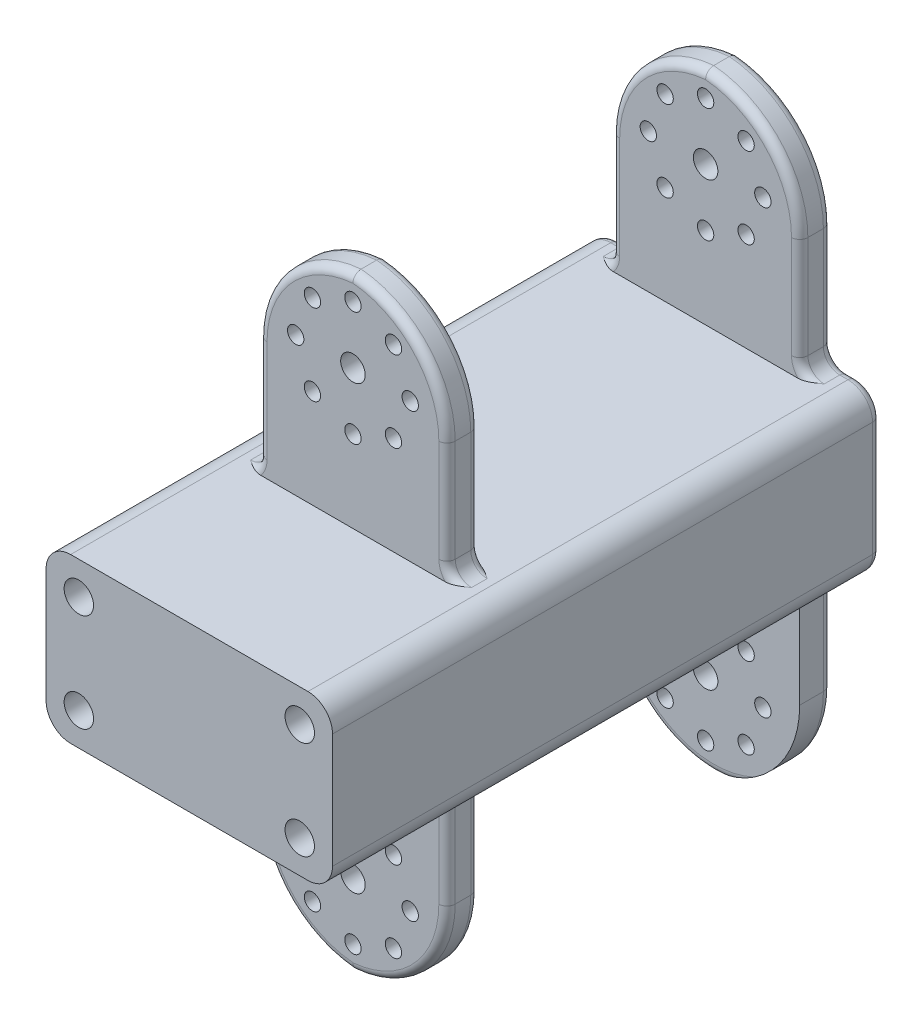
from build123d import *

# Parameters (mm, degrees)
SKETCH1_W           = 35
SKETCH1_H           = 47
BOSS_EXTRUDE1_DEPTH = 20
SKETCH7_W           = 35
SKETCH7_H           = 20
BOSS_EXTRUDE3_DEPTH = 20
SKETCH2_W           = 23
SKETCH2_H           = 3.9
BOSS_EXTRUDE5_DEPTH = 27
SKETCH10_R          = 1
SKETCH10_R_2        = 1.5
CUT_EXTRUDE3_DEPTH  = 50
FILLET1_R           = 12.5
FILLET3_R           = 3
FILLET4_R           = 2
FILLET5_R           = 1
SKETCH11_R          = 1.8
CUT_EXTRUDE4_DEPTH  = 3


with BuildPart() as part:
    # Sketch1 → Boss-Extrude1 (new body)
    with BuildSketch(Plane(origin=(0, 0, 0), x_dir=(1, 0, 0), z_dir=(0, 1, 0))):
        with Locations((5, 1)):
            Rectangle(SKETCH1_W, SKETCH1_H)
    extrude(amount=BOSS_EXTRUDE1_DEPTH)

    # Sketch7 → Boss-Extrude3 (add)
    with BuildSketch(Plane.XY.offset(22.5)):
        with Locations((5, 10)):
            Rectangle(SKETCH7_W, SKETCH7_H)
    extrude(amount=BOSS_EXTRUDE3_DEPTH)

    # Sketch2 → Boss-Extrude5 (add)
    with BuildSketch(Plane.XZ):
        with Locations((5, -22.55)):
            Rectangle(SKETCH2_W, SKETCH2_H)
        with Locations((5, 20.55)):
            Rectangle(SKETCH2_W, SKETCH2_H)
    boss_extrude5 = extrude(amount=BOSS_EXTRUDE5_DEPTH)

    # Sketch10 → Cut-Extrude3 (cut)
    with BuildSketch(Plane(origin=(0, 0, -24.5), x_dir=(-1, 0, 0), z_dir=(0, 0, -1))):
        with Locations((-5, -24)):
            Circle(SKETCH10_R)
        with Locations((-5, -17)):
            Circle(SKETCH10_R_2)
        with Locations((-9.949747468, -21.949747468)):
            Circle(SKETCH10_R)
        with Locations((-0.050252532, -21.949747468)):
            Circle(SKETCH10_R)
        with Locations((-12, -17)):
            Circle(SKETCH10_R)
        with Locations((2, -17)):
            Circle(SKETCH10_R)
        with Locations((-9.949747468, -12.050252532)):
            Circle(SKETCH10_R)
        with Locations((-0.050252532, -12.050252532)):
            Circle(SKETCH10_R)
        with Locations((-5, -10)):
            Circle(SKETCH10_R)
    cut_extrude3 = extrude(amount=-CUT_EXTRUDE3_DEPTH, mode=Mode.SUBTRACT)

    # Mirror3: Boss-Extrude5, Cut-Extrude3 across plane
    add(boss_extrude5.mirror(Plane.ZX.offset(10)))
    add(cut_extrude3.mirror(Plane.ZX.offset(10)), mode=Mode.SUBTRACT)

    # Fillet1
    # the kernel refuses this fillet: 12.5 mm, written as the material it takes off along each edge
    with BuildSketch(Plane(origin=(-6.5, 47, 53.75), x_dir=(0, -1, 0), z_dir=(0, 0, -1)), Plane(origin=(16.5, 47, -12.65), x_dir=(0, -1, 0), z_dir=(0, 0, 1)), Plane(origin=(-6.5, 47, 10.65), x_dir=(0, -1, 0), z_dir=(0, 0, -1)), Plane(origin=(16.5, -27, -55.75), x_dir=(-1, 0, 0), z_dir=(0, 0, 1))) as fillet1_piece_1:
        with BuildLine():
            CenterArc((FILLET1_R, -FILLET1_R), FILLET1_R, 90, 90)
            Line((0, -FILLET1_R), (0, 0))
            Line((0, 0), (FILLET1_R, 0))
        make_face()
    extrude(amount=66.4, mode=Mode.SUBTRACT)
    with BuildSketch(Plane(origin=(16.5, 47, -55.75), x_dir=(-1, 0, 0), z_dir=(0, 0, 1)), Plane(origin=(-6.5, -27, 10.65), x_dir=(0, 1, 0), z_dir=(0, 0, -1)), Plane(origin=(-6.5, -27, 53.75), x_dir=(0, 1, 0), z_dir=(0, 0, -1)), Plane(origin=(16.5, -27, -12.65), x_dir=(0, 1, 0), z_dir=(0, 0, 1))) as fillet1_piece_2:
        with BuildLine():
            CenterArc((FILLET1_R, FILLET1_R), FILLET1_R, 180, 90)
            Line((0, FILLET1_R), (0, 0))
            Line((0, 0), (FILLET1_R, 0))
        make_face()
    extrude(amount=66.4, mode=Mode.SUBTRACT)

    # Fillet3
    fillet3_edges = [part.edges().sort_by_distance(p)[0] for p in [
        (22.5, 20, 9),
        (-12.5, 20, 9),
        (22.5, 0, 9),
        (-12.5, 0, 9),
    ]]
    fillet(fillet3_edges, radius=FILLET3_R)

    # Fillet4
    fillet4_edges = [part.edges().sort_by_distance(p)[0] for p in [
        (-6.5, 20, 20.55),
        (16.5, 20, 20.55),
        (-6.5, 20, -22.55),
        (16.5, 20, -22.55),
        (-6.5, 0, 20.55),
        (16.5, 0, 20.55),
        (-6.5, 0, -22.55),
        (16.5, 0, -22.55),
    ]]
    fillet(fillet4_edges, radius=FILLET4_R)

    # Fillet5
    # the kernel refuses this fillet: 1 mm, written as the material it takes off along each edge
    with BuildSketch(Plane(origin=(-6.5, 22, 22.5), x_dir=(0, 0, -1), z_dir=(0, 1, 0)), Plane(origin=(-6.5, 22, 18.6), x_dir=(1, 0, 0), z_dir=(0, 1, 0)), Plane(origin=(-6.5, 22, -24.5), x_dir=(1, 0, 0), z_dir=(0, 1, 0)), Plane(origin=(16.5, -2, -24.5), x_dir=(-1, 0, 0), z_dir=(0, -1, 0)), Plane(origin=(16.5, 22, -20.6), x_dir=(-1, 0, 0), z_dir=(0, 1, 0)), Plane(origin=(-6.5, -2, -20.6), x_dir=(1, 0, 0), z_dir=(0, -1, 0)), Plane(origin=(-6.5, -2, 18.6), x_dir=(0, 0, 1), z_dir=(0, -1, 0)), Plane(origin=(16.5, -2, 22.5), x_dir=(0, 0, -1), z_dir=(0, -1, 0))) as fillet5_piece_1:
        with BuildLine():
            CenterArc((FILLET5_R, -FILLET5_R), FILLET5_R, 90, 90)
            Line((0, -FILLET5_R), (0, 0))
            Line((0, 0), (FILLET5_R, 0))
        make_face()
    extrude(amount=12.5, mode=Mode.SUBTRACT)
    with BuildSketch(Plane(origin=(16.5, 22, 18.6), x_dir=(-1, 0, 0), z_dir=(0, 1, 0)), Plane(origin=(16.5, 22, 22.5), x_dir=(0, 0, -1), z_dir=(0, 1, 0)), Plane(origin=(-6.5, 22, -20.6), x_dir=(1, 0, 0), z_dir=(0, 1, 0)), Plane(origin=(-6.5, -2, -24.5), x_dir=(1, 0, 0), z_dir=(0, -1, 0)), Plane(origin=(16.5, 22, -24.5), x_dir=(-1, 0, 0), z_dir=(0, 1, 0)), Plane(origin=(16.5, -2, 18.6), x_dir=(0, 0, 1), z_dir=(0, -1, 0)), Plane(origin=(-6.5, -2, 22.5), x_dir=(0, 0, -1), z_dir=(0, -1, 0))) as fillet5_piece_2:
        with BuildLine():
            CenterArc((FILLET5_R, FILLET5_R), FILLET5_R, 180, 90)
            Line((0, FILLET5_R), (0, 0))
            Line((0, 0), (FILLET5_R, 0))
        make_face()
    extrude(amount=12.5, mode=Mode.SUBTRACT)
    with BuildSketch(Plane(origin=(4, 34.5, 18.6), x_dir=(-0.49699424174803253, 0.8677538381760683, 0), z_dir=(-0.8677538381760683, -0.49699424174803253, 0))) as fillet5_piece_3:
        with BuildLine():
            CenterArc((12.5 - FILLET5_R, -FILLET5_R), FILLET5_R, 360, 90)
            Line((12.5, -FILLET5_R), (12.5, 0))
            Line((12.5, 0), (12.5 - FILLET5_R, 0))
        make_face()
    revolve(axis=Axis((4, 34.5, 18.6), (0, 0, -1)), revolution_arc=119.80133908, mode=Mode.SUBTRACT)
    with BuildSketch(Plane(origin=(6, 34.5, 18.6), x_dir=(0.4969942417480113, 0.8677538381760804, 0), z_dir=(0.8677538381760804, -0.4969942417480113, 0))) as fillet5_piece_4:
        with BuildLine():
            CenterArc((12.5 - FILLET5_R, FILLET5_R), FILLET5_R, 270, 90)
            Line((12.5, FILLET5_R), (12.5, 0))
            Line((12.5, 0), (12.5 - FILLET5_R, 0))
        make_face()
    revolve(axis=Axis((6, 34.5, 18.6), (0, 0, 1)), revolution_arc=119.80133908, mode=Mode.SUBTRACT)
    with BuildSketch(Plane(origin=(4, 34.5, 22.5), x_dir=(-0.4969942417480322, 0.8677538381760685, 0), z_dir=(-0.8677538381760685, -0.4969942417480322, 0))) as fillet5_piece_5:
        with BuildLine():
            CenterArc((12.5 - FILLET5_R, FILLET5_R), FILLET5_R, 270, 90)
            Line((12.5 - FILLET5_R, 0), (12.5, 0))
            Line((12.5, 0), (12.5, FILLET5_R))
        make_face()
    revolve(axis=Axis((4, 34.5, 22.5), (0, 0, -1)), revolution_arc=119.80133908, mode=Mode.SUBTRACT)
    with BuildSketch(Plane(origin=(6, 34.5, 22.5), x_dir=(0.4969942417480117, 0.8677538381760802, 0), z_dir=(0.8677538381760802, -0.4969942417480117, 0))) as fillet5_piece_6:
        with BuildLine():
            CenterArc((12.5 - FILLET5_R, -FILLET5_R), FILLET5_R, 0, 90)
            Line((12.5 - FILLET5_R, 0), (12.5, 0))
            Line((12.5, 0), (12.5, -FILLET5_R))
        make_face()
    revolve(axis=Axis((6, 34.5, 22.5), (0, 0, 1)), revolution_arc=119.80133908, mode=Mode.SUBTRACT)
    with BuildSketch(Plane(origin=(4, -14.5, -24.5), x_dir=(1, 0, 0), z_dir=(0, 1, 0))) as fillet5_piece_7:
        with BuildLine():
            CenterArc((12.5 - FILLET5_R, -FILLET5_R), FILLET5_R, 0, 90)
            Line((12.5, -FILLET5_R), (12.5, 0))
            Line((12.5, 0), (12.5 - FILLET5_R, 0))
        make_face()
    revolve(axis=Axis((4, -14.5, -24.5), (0, 0, -1)), revolution_arc=119.80133908, mode=Mode.SUBTRACT)
    with BuildSketch(Plane(origin=(6, -14.5, -24.5), x_dir=(-1, 0, 0), z_dir=(0, 1, 0))) as fillet5_piece_8:
        with BuildLine():
            CenterArc((12.5 - FILLET5_R, FILLET5_R), FILLET5_R, 270, 90)
            Line((12.5, FILLET5_R), (12.5, 0))
            Line((12.5, 0), (12.5 - FILLET5_R, 0))
        make_face()
    revolve(axis=Axis((6, -14.5, -24.5), (0, 0, 1)), revolution_arc=119.80133908, mode=Mode.SUBTRACT)
    with BuildSketch(Plane(origin=(4, 34.5, -24.5), x_dir=(-0.4969942417480215, 0.8677538381760747, 0), z_dir=(-0.8677538381760747, -0.4969942417480215, 0))) as fillet5_piece_9:
        with BuildLine():
            CenterArc((12.5 - FILLET5_R, -FILLET5_R), FILLET5_R, 0, 90)
            Line((12.5, -FILLET5_R), (12.5, 0))
            Line((12.5, 0), (12.5 - FILLET5_R, 0))
        make_face()
    revolve(axis=Axis((4, 34.5, -24.5), (0, 0, -1)), revolution_arc=119.80133908, mode=Mode.SUBTRACT)
    with BuildSketch(Plane(origin=(6, 34.5, -24.5), x_dir=(0.4969942417480217, 0.8677538381760745, 0), z_dir=(0.8677538381760745, -0.4969942417480217, 0))) as fillet5_piece_10:
        with BuildLine():
            CenterArc((12.5 - FILLET5_R, FILLET5_R), FILLET5_R, 270, 90)
            Line((12.5, FILLET5_R), (12.5, 0))
            Line((12.5, 0), (12.5 - FILLET5_R, 0))
        make_face()
    revolve(axis=Axis((6, 34.5, -24.5), (0, 0, 1)), revolution_arc=119.80133908, mode=Mode.SUBTRACT)
    with BuildSketch(Plane(origin=(4, 34.5, -20.6), x_dir=(-0.4969942417480215, 0.8677538381760747, 0), z_dir=(-0.8677538381760747, -0.4969942417480215, 0))) as fillet5_piece_11:
        with BuildLine():
            CenterArc((12.5 - FILLET5_R, FILLET5_R), FILLET5_R, 270, 90)
            Line((12.5, FILLET5_R), (12.5, 0))
            Line((12.5, 0), (12.5 - FILLET5_R, 0))
        make_face()
    revolve(axis=Axis((4, 34.5, -20.6), (0, 0, -1)), revolution_arc=119.80133908, mode=Mode.SUBTRACT)
    with BuildSketch(Plane(origin=(6, 34.5, -20.6), x_dir=(0.4969942417480217, 0.8677538381760745, 0), z_dir=(0.8677538381760745, -0.4969942417480217, 0))) as fillet5_piece_12:
        with BuildLine():
            CenterArc((12.5 - FILLET5_R, -FILLET5_R), FILLET5_R, 0, 90)
            Line((12.5, -FILLET5_R), (12.5, 0))
            Line((12.5, 0), (12.5 - FILLET5_R, 0))
        make_face()
    revolve(axis=Axis((6, 34.5, -20.6), (0, 0, 1)), revolution_arc=119.80133908, mode=Mode.SUBTRACT)
    with BuildSketch(Plane(origin=(6, -14.5, -20.6), x_dir=(-1, 0, 0), z_dir=(0, 1, 0))) as fillet5_piece_13:
        with BuildLine():
            CenterArc((12.5 - FILLET5_R, -FILLET5_R), FILLET5_R, 0, 90)
            Line((12.5, -FILLET5_R), (12.5, 0))
            Line((12.5, 0), (12.5 - FILLET5_R, 0))
        make_face()
    revolve(axis=Axis((6, -14.5, -20.6), (0, 0, 1)), revolution_arc=119.80133908, mode=Mode.SUBTRACT)
    with BuildSketch(Plane(origin=(4, -14.5, 18.6), x_dir=(1, 0, 0), z_dir=(0, 1, 0))) as fillet5_piece_14:
        with BuildLine():
            CenterArc((12.5 - FILLET5_R, -FILLET5_R), FILLET5_R, 0, 90)
            Line((12.5 - FILLET5_R, 0), (12.5, 0))
            Line((12.5, 0), (12.5, -FILLET5_R))
        make_face()
    revolve(axis=Axis((4, -14.5, 18.6), (0, 0, -1)), revolution_arc=119.80133908, mode=Mode.SUBTRACT)
    with BuildSketch(Plane(origin=(6, -14.5, 18.6), x_dir=(-1, 0, 0), z_dir=(0, 1, 0))) as fillet5_piece_15:
        with BuildLine():
            CenterArc((12.5 - FILLET5_R, FILLET5_R), FILLET5_R, 270, 90)
            Line((12.5 - FILLET5_R, 0), (12.5, 0))
            Line((12.5, 0), (12.5, FILLET5_R))
        make_face()
    revolve(axis=Axis((6, -14.5, 18.6), (0, 0, 1)), revolution_arc=119.80133908, mode=Mode.SUBTRACT)
    with BuildSketch(Plane(origin=(4, -14.5, 22.5), x_dir=(1, 0, 0), z_dir=(0, 1, 0))) as fillet5_piece_16:
        with BuildLine():
            CenterArc((12.5 - FILLET5_R, FILLET5_R), FILLET5_R, 270, 90)
            Line((12.5 - FILLET5_R, 0), (12.5, 0))
            Line((12.5, 0), (12.5, FILLET5_R))
        make_face()
    revolve(axis=Axis((4, -14.5, 22.5), (0, 0, -1)), revolution_arc=119.80133908, mode=Mode.SUBTRACT)
    with BuildSketch(Plane(origin=(6, -14.5, 22.5), x_dir=(-1, 0, 0), z_dir=(0, 1, 0))) as fillet5_piece_17:
        with BuildLine():
            CenterArc((12.5 - FILLET5_R, -FILLET5_R), FILLET5_R, 0, 90)
            Line((12.5 - FILLET5_R, 0), (12.5, 0))
            Line((12.5, 0), (12.5, -FILLET5_R))
        make_face()
    revolve(axis=Axis((6, -14.5, 22.5), (0, 0, 1)), revolution_arc=119.80133908, mode=Mode.SUBTRACT)
    with BuildSketch(Plane(origin=(-12.5, 3, -24.5), x_dir=(1, 0, 0), z_dir=(0, 1, 0))) as fillet5_piece_18:
        with BuildLine():
            CenterArc((FILLET5_R, -FILLET5_R), FILLET5_R, 90, 90)
            Line((0, -FILLET5_R), (0, 0))
            Line((0, 0), (FILLET5_R, 0))
        make_face()
    extrude(amount=14, mode=Mode.SUBTRACT)
    with BuildSketch(Plane(origin=(18.5, 0, -24.5), x_dir=(0, 1, 0), z_dir=(1, 0, 0)), Plane(origin=(-9.5, 0, -24.5), x_dir=(0, 1, 0), z_dir=(1, 0, 0))) as fillet5_piece_19:
        with BuildLine():
            CenterArc((FILLET5_R, FILLET5_R), FILLET5_R, 180, 90)
            Line((0, FILLET5_R), (0, 0))
            Line((0, 0), (FILLET5_R, 0))
        make_face()
    extrude(amount=1, mode=Mode.SUBTRACT)
    with BuildSketch(Plane(origin=(18.5, 20, -24.5), x_dir=(0, -1, 0), z_dir=(1, 0, 0)), Plane(origin=(-9.5, 20, -24.5), x_dir=(0, -1, 0), z_dir=(1, 0, 0))) as fillet5_piece_20:
        with BuildLine():
            CenterArc((FILLET5_R, -FILLET5_R), FILLET5_R, 90, 90)
            Line((0, -FILLET5_R), (0, 0))
            Line((0, 0), (FILLET5_R, 0))
        make_face()
    extrude(amount=1, mode=Mode.SUBTRACT)
    with BuildSketch(Plane(origin=(22.5, 3, -24.5), x_dir=(-1, 0, 0), z_dir=(0, 1, 0))) as fillet5_piece_21:
        with BuildLine():
            CenterArc((FILLET5_R, FILLET5_R), FILLET5_R, 180, 90)
            Line((0, FILLET5_R), (0, 0))
            Line((0, 0), (FILLET5_R, 0))
        make_face()
    extrude(amount=14, mode=Mode.SUBTRACT)
    with BuildSketch(Plane(origin=(19.5, 3, -24.5), x_dir=(0, -1, 0), z_dir=(-1, 0, 0))) as fillet5_piece_22:
        with BuildLine():
            CenterArc((3 - FILLET5_R, FILLET5_R), FILLET5_R, 270, 90)
            Line((3, FILLET5_R), (3, 0))
            Line((3, 0), (3 - FILLET5_R, 0))
        make_face()
    revolve(axis=Axis((19.5, 3, -24.5), (0, 0, 1)), revolution_arc=90, mode=Mode.SUBTRACT)
    with BuildSketch(Plane(origin=(19.5, 17, -24.5), x_dir=(1, 0, 0), z_dir=(0, -1, 0))) as fillet5_piece_23:
        with BuildLine():
            CenterArc((3 - FILLET5_R, FILLET5_R), FILLET5_R, 270, 90)
            Line((3, FILLET5_R), (3, 0))
            Line((3, 0), (3 - FILLET5_R, 0))
        make_face()
    revolve(axis=Axis((19.5, 17, -24.5), (0, 0, 1)), revolution_arc=90, mode=Mode.SUBTRACT)
    with BuildSketch(Plane(origin=(-9.5, 17, -24.5), x_dir=(0, 1, 0), z_dir=(1, 0, 0))) as fillet5_piece_24:
        with BuildLine():
            CenterArc((3 - FILLET5_R, FILLET5_R), FILLET5_R, 270, 90)
            Line((3, FILLET5_R), (3, 0))
            Line((3, 0), (3 - FILLET5_R, 0))
        make_face()
    revolve(axis=Axis((-9.5, 17, -24.5), (0, 0, 1)), revolution_arc=90, mode=Mode.SUBTRACT)
    with BuildSketch(Plane(origin=(-9.5, 3, -24.5), x_dir=(0, -1, 0), z_dir=(1, 0, 0))) as fillet5_piece_25:
        with BuildLine():
            CenterArc((3 - FILLET5_R, -FILLET5_R), FILLET5_R, 0, 90)
            Line((3, -FILLET5_R), (3, 0))
            Line((3, 0), (3 - FILLET5_R, 0))
        make_face()
    revolve(axis=Axis((-9.5, 3, -24.5), (0, 0, -1)), revolution_arc=90, mode=Mode.SUBTRACT)
    with BuildSketch(Plane(origin=(-8.5, -2, -24.5), x_dir=(0, 1, 0), z_dir=(-1, 0, 0))) as fillet5_piece_26:
        with BuildLine():
            CenterArc((2 + FILLET5_R, -FILLET5_R), FILLET5_R, 90, 90)
            Line((2, -FILLET5_R), (2, 0))
            Line((2, 0), (2 + FILLET5_R, 0))
        make_face()
    revolve(axis=Axis((-8.5, -2, -24.5), (0, 0, -1)), revolution_arc=90, mode=Mode.SUBTRACT)
    with BuildSketch(Plane(origin=(-8.5, -2, -20.6), x_dir=(-0.949142834166083, 0.3148458040869775, 0), z_dir=(-0.3148458040869775, -0.949142834166083, 0))) as fillet5_piece_27_section:
        with BuildLine():
            CenterArc((2 + FILLET5_R, FILLET5_R), FILLET5_R, 180, 90)
            Line((2, FILLET5_R), (2, 0))
            Line((2, 0), (2 + FILLET5_R, 0))
        make_face()
    fillet5_piece_27 = revolve(axis=Axis((-8.5, -2, -20.6), (0, 0, -1)), revolution_arc=161.648494619, mode=Mode.PRIVATE)
    fillet5_piece_27 = split(fillet5_piece_27, bisect_by=Plane(origin=(-8.5, 0, -20.6), z_dir=(0, -1, 0)), keep=Keep.TOP, mode=Mode.PRIVATE)
    add(fillet5_piece_27, mode=Mode.SUBTRACT)
    with BuildSketch(Plane(origin=(18.5, -2, -24.5), x_dir=(0, 1, 0), z_dir=(1, 0, 0))) as fillet5_piece_28:
        with BuildLine():
            CenterArc((2 + FILLET5_R, FILLET5_R), FILLET5_R, 180, 90)
            Line((2, FILLET5_R), (2, 0))
            Line((2, 0), (2 + FILLET5_R, 0))
        make_face()
    revolve(axis=Axis((18.5, -2, -24.5), (0, 0, 1)), revolution_arc=90, mode=Mode.SUBTRACT)
    with BuildSketch(Plane(origin=(18.5, -2, 22.5), x_dir=(0.9491428341660828, 0.31484580408697826, 0), z_dir=(0.31484580408697826, -0.9491428341660828, 0))) as fillet5_piece_29_section:
        with BuildLine():
            CenterArc((2 + FILLET5_R, -FILLET5_R), FILLET5_R, 90, 90)
            Line((2 + FILLET5_R, 0), (2, 0))
            Line((2, 0), (2, -FILLET5_R))
        make_face()
    fillet5_piece_29 = revolve(axis=Axis((18.5, -2, 22.5), (0, 0, 1)), revolution_arc=161.648494619, mode=Mode.PRIVATE)
    fillet5_piece_29 = split(fillet5_piece_29, bisect_by=Plane(origin=(18.5, 0, 22.5), z_dir=(0, -1, 0)), keep=Keep.TOP, mode=Mode.PRIVATE)
    add(fillet5_piece_29, mode=Mode.SUBTRACT)
    with BuildSketch(Plane(origin=(18.5, -2, 18.6), x_dir=(0.9491428341660828, 0.31484580408697826, 0), z_dir=(0.31484580408697826, -0.9491428341660828, 0))) as fillet5_piece_30_section:
        with BuildLine():
            CenterArc((2 + FILLET5_R, FILLET5_R), FILLET5_R, 180, 90)
            Line((2, FILLET5_R), (2, 0))
            Line((2, 0), (2 + FILLET5_R, 0))
        make_face()
    fillet5_piece_30 = revolve(axis=Axis((18.5, -2, 18.6), (0, 0, 1)), revolution_arc=161.648494619, mode=Mode.PRIVATE)
    fillet5_piece_30 = split(fillet5_piece_30, bisect_by=Plane(origin=(18.5, 0, 18.6), z_dir=(0, -1, 0)), keep=Keep.TOP, mode=Mode.PRIVATE)
    add(fillet5_piece_30, mode=Mode.SUBTRACT)
    with BuildSketch(Plane(origin=(-8.5, -2, 18.6), x_dir=(-0.9491428341660828, 0.3148458040869783, 0), z_dir=(-0.3148458040869783, -0.9491428341660828, 0))) as fillet5_piece_31_section:
        with BuildLine():
            CenterArc((2 + FILLET5_R, -FILLET5_R), FILLET5_R, 90, 90)
            Line((2 + FILLET5_R, 0), (2, 0))
            Line((2, 0), (2, -FILLET5_R))
        make_face()
    fillet5_piece_31 = revolve(axis=Axis((-8.5, -2, 18.6), (0, 0, -1)), revolution_arc=161.648494619, mode=Mode.PRIVATE)
    fillet5_piece_31 = split(fillet5_piece_31, bisect_by=Plane(origin=(-8.5, 0, 18.6), z_dir=(0, -1, 0)), keep=Keep.TOP, mode=Mode.PRIVATE)
    add(fillet5_piece_31, mode=Mode.SUBTRACT)
    with BuildSketch(Plane(origin=(-8.5, -2, 22.5), x_dir=(-0.949142834166083, 0.3148458040869775, 0), z_dir=(-0.3148458040869775, -0.949142834166083, 0))) as fillet5_piece_32_section:
        with BuildLine():
            CenterArc((2 + FILLET5_R, FILLET5_R), FILLET5_R, 180, 90)
            Line((2 + FILLET5_R, 0), (2, 0))
            Line((2, 0), (2, FILLET5_R))
        make_face()
    fillet5_piece_32 = revolve(axis=Axis((-8.5, -2, 22.5), (0, 0, -1)), revolution_arc=161.648494619, mode=Mode.PRIVATE)
    fillet5_piece_32 = split(fillet5_piece_32, bisect_by=Plane(origin=(-8.5, 0, 22.5), z_dir=(0, -1, 0)), keep=Keep.TOP, mode=Mode.PRIVATE)
    add(fillet5_piece_32, mode=Mode.SUBTRACT)
    with BuildSketch(Plane(origin=(-8.5, 22, 18.6), x_dir=(-0.9491428341660828, -0.3148458040869783, 0), z_dir=(-0.3148458040869783, 0.9491428341660828, 0))) as fillet5_piece_33_section:
        with BuildLine():
            CenterArc((2 + FILLET5_R, FILLET5_R), FILLET5_R, 180, 90)
            Line((2, FILLET5_R), (2, 0))
            Line((2, 0), (2 + FILLET5_R, 0))
        make_face()
    fillet5_piece_33 = revolve(axis=Axis((-8.5, 22, 18.6), (0, 0, 1)), revolution_arc=161.648494619, mode=Mode.PRIVATE)
    fillet5_piece_33 = split(fillet5_piece_33, bisect_by=Plane(origin=(-8.5, 20, 18.6), z_dir=(0, 1, 0)), keep=Keep.TOP, mode=Mode.PRIVATE)
    add(fillet5_piece_33, mode=Mode.SUBTRACT)
    with BuildSketch(Plane(origin=(-8.5, 22, 22.5), x_dir=(-0.9491428341660834, -0.3148458040869767, 0), z_dir=(-0.3148458040869767, 0.9491428341660834, 0))) as fillet5_piece_34_section:
        with BuildLine():
            CenterArc((2 + FILLET5_R, -FILLET5_R), FILLET5_R, 90, 90)
            Line((2, -FILLET5_R), (2, 0))
            Line((2, 0), (2 + FILLET5_R, 0))
        make_face()
    fillet5_piece_34 = revolve(axis=Axis((-8.5, 22, 22.5), (0, 0, 1)), revolution_arc=161.648494619, mode=Mode.PRIVATE)
    fillet5_piece_34 = split(fillet5_piece_34, bisect_by=Plane(origin=(-8.5, 20, 22.5), z_dir=(0, 1, 0)), keep=Keep.TOP, mode=Mode.PRIVATE)
    add(fillet5_piece_34, mode=Mode.SUBTRACT)
    with BuildSketch(Plane(origin=(18.5, 22, 22.5), x_dir=(0.9491428341660828, -0.3148458040869786, 0), z_dir=(0.3148458040869786, 0.9491428341660828, 0))) as fillet5_piece_35_section:
        with BuildLine():
            CenterArc((2 + FILLET5_R, FILLET5_R), FILLET5_R, 180, 90)
            Line((2 + FILLET5_R, 0), (2, 0))
            Line((2, 0), (2, FILLET5_R))
        make_face()
    fillet5_piece_35 = revolve(axis=Axis((18.5, 22, 22.5), (0, 0, -1)), revolution_arc=161.648494619, mode=Mode.PRIVATE)
    fillet5_piece_35 = split(fillet5_piece_35, bisect_by=Plane(origin=(18.5, 20, 22.5), z_dir=(0, 1, 0)), keep=Keep.TOP, mode=Mode.PRIVATE)
    add(fillet5_piece_35, mode=Mode.SUBTRACT)
    with BuildSketch(Plane(origin=(18.5, 22, 18.6), x_dir=(0.9491428341660828, -0.3148458040869786, 0), z_dir=(0.3148458040869786, 0.9491428341660828, 0))) as fillet5_piece_36_section:
        with BuildLine():
            CenterArc((2 + FILLET5_R, -FILLET5_R), FILLET5_R, 90, 90)
            Line((2, -FILLET5_R), (2, 0))
            Line((2, 0), (2 + FILLET5_R, 0))
        make_face()
    fillet5_piece_36 = revolve(axis=Axis((18.5, 22, 18.6), (0, 0, -1)), revolution_arc=161.648494619, mode=Mode.PRIVATE)
    fillet5_piece_36 = split(fillet5_piece_36, bisect_by=Plane(origin=(18.5, 20, 18.6), z_dir=(0, 1, 0)), keep=Keep.TOP, mode=Mode.PRIVATE)
    add(fillet5_piece_36, mode=Mode.SUBTRACT)
    with BuildSketch(Plane(origin=(18.5, 22, -20.6), x_dir=(0.9491428341660828, -0.3148458040869786, 0), z_dir=(0.3148458040869786, 0.9491428341660828, 0))) as fillet5_piece_37_section:
        with BuildLine():
            CenterArc((2 + FILLET5_R, FILLET5_R), FILLET5_R, 180, 90)
            Line((2, FILLET5_R), (2, 0))
            Line((2, 0), (2 + FILLET5_R, 0))
        make_face()
    fillet5_piece_37 = revolve(axis=Axis((18.5, 22, -20.6), (0, 0, -1)), revolution_arc=161.648494619, mode=Mode.PRIVATE)
    fillet5_piece_37 = split(fillet5_piece_37, bisect_by=Plane(origin=(18.5, 20, -20.6), z_dir=(0, 1, 0)), keep=Keep.TOP, mode=Mode.PRIVATE)
    add(fillet5_piece_37, mode=Mode.SUBTRACT)
    with BuildSketch(Plane(origin=(18.5, 22, -24.5), x_dir=(0, -1, 0), z_dir=(1, 0, 0))) as fillet5_piece_38:
        with BuildLine():
            CenterArc((2 + FILLET5_R, -FILLET5_R), FILLET5_R, 90, 90)
            Line((2, -FILLET5_R), (2, 0))
            Line((2, 0), (2 + FILLET5_R, 0))
        make_face()
    revolve(axis=Axis((18.5, 22, -24.5), (0, 0, -1)), revolution_arc=90, mode=Mode.SUBTRACT)
    with BuildSketch(Plane(origin=(-8.5, 22, -24.5), x_dir=(0, -1, 0), z_dir=(-1, 0, 0))) as fillet5_piece_39:
        with BuildLine():
            CenterArc((2 + FILLET5_R, FILLET5_R), FILLET5_R, 180, 90)
            Line((2, FILLET5_R), (2, 0))
            Line((2, 0), (2 + FILLET5_R, 0))
        make_face()
    revolve(axis=Axis((-8.5, 22, -24.5), (0, 0, 1)), revolution_arc=90, mode=Mode.SUBTRACT)
    with BuildSketch(Plane(origin=(-8.5, 22, -20.6), x_dir=(-0.9491428341660834, -0.3148458040869767, 0), z_dir=(-0.3148458040869767, 0.9491428341660834, 0))) as fillet5_piece_40_section:
        with BuildLine():
            CenterArc((2 + FILLET5_R, -FILLET5_R), FILLET5_R, 90, 90)
            Line((2, -FILLET5_R), (2, 0))
            Line((2, 0), (2 + FILLET5_R, 0))
        make_face()
    fillet5_piece_40 = revolve(axis=Axis((-8.5, 22, -20.6), (0, 0, 1)), revolution_arc=161.648494619, mode=Mode.PRIVATE)
    fillet5_piece_40 = split(fillet5_piece_40, bisect_by=Plane(origin=(-8.5, 20, -20.6), z_dir=(0, 1, 0)), keep=Keep.TOP, mode=Mode.PRIVATE)
    add(fillet5_piece_40, mode=Mode.SUBTRACT)

    # Sketch11 → Cut-Extrude4 (cut)
    with BuildSketch(Plane.XY.offset(42.5)):
        with Locations((-8.5, 4)):
            Circle(SKETCH11_R)
        with Locations((18.5, 4)):
            Circle(SKETCH11_R)
        with Locations((18.5, 16)):
            Circle(SKETCH11_R)
        with Locations((-8.5, 16)):
            Circle(SKETCH11_R)
    extrude(amount=-CUT_EXTRUDE4_DEPTH, mode=Mode.SUBTRACT)


solid = part.part
